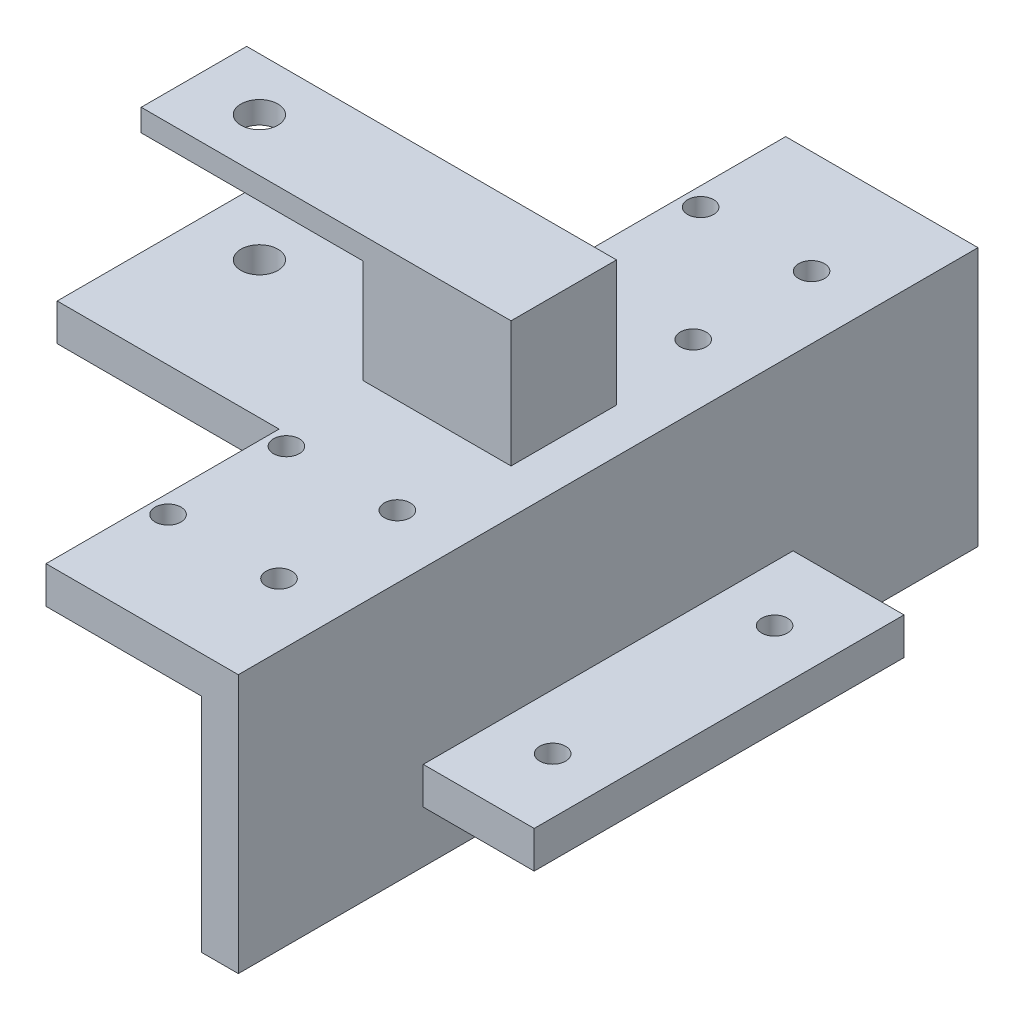
from build123d import *

# Parameters (mm, degrees)
SKETCH1_R               = 1.75
BOSS_EXTRUDE1_DEPTH     = 5
SKETCH2_W               = 100
SKETCH2_H               = 35
BOSS_EXTRUDE2_DEPTH     = 5
SKETCH3_W               = 50
SKETCH3_H               = 5
BOSS_EXTRUDE3_DEPTH     = 15
SKETCH4_R               = 1.75
CUT_EXTRUDE1_DEPTH      = 64.166446789
SKETCH5_W               = 20
SKETCH5_H               = 14.257959778
BOSS_EXTRUDE4_DEPTH     = 17
SKETCH6_W               = 14.257959778
SKETCH6_H               = 3
SKETCH6_W_2             = 36.976915342
SKETCH6_H_2             = 5
BOSS_EXTRUDE5_DEPTH     = 30
CUT_EXTRUDE2_DEPTH      = 73.972597597
CUT_EXTRUDE2_DEPTH_BACK = 73.972597597
SKETCH7_R               = 2.5


with BuildPart() as part:
    # Sketch1 → Boss-Extrude1 (new body)
    with BuildSketch(Plane(origin=(0, 0, 0), x_dir=(1, 0, 0), z_dir=(0, 1, 0))):
        Polygon((-10, 50), (10, 50), (11, 50), (11, -50), (10, -50), (-10, -50), align=None)
        with Locations((-7.5, 36)):
            Circle(SKETCH1_R, mode=Mode.SUBTRACT)
        with Locations((7.5, 36)):
            Circle(SKETCH1_R, mode=Mode.SUBTRACT)
        with Locations((-7.5, 20)):
            Circle(SKETCH1_R, mode=Mode.SUBTRACT)
        with Locations((7.5, 20)):
            Circle(SKETCH1_R, mode=Mode.SUBTRACT)
        with Locations((7.5, -20)):
            Circle(SKETCH1_R, mode=Mode.SUBTRACT)
        with Locations((-7.5, -20)):
            Circle(SKETCH1_R, mode=Mode.SUBTRACT)
        with Locations((7.5, -36)):
            Circle(SKETCH1_R, mode=Mode.SUBTRACT)
        with Locations((-7.5, -36)):
            Circle(SKETCH1_R, mode=Mode.SUBTRACT)
    extrude(amount=BOSS_EXTRUDE1_DEPTH)

    # Sketch2 → Boss-Extrude2 (add)
    with BuildSketch(Plane(origin=(11, 0, 0), x_dir=(0, 0, -1), z_dir=(1, 0, 0))):
        with Locations((0, -12.5)):
            Rectangle(SKETCH2_W, SKETCH2_H)
    extrude(amount=BOSS_EXTRUDE2_DEPTH)

    # Sketch3 → Boss-Extrude3 (add)
    with BuildSketch(Plane(origin=(16, 0, 0), x_dir=(0, 0, -1), z_dir=(1, 0, 0))):
        with Locations((0, -20.5)):
            Rectangle(SKETCH3_W, SKETCH3_H)
    extrude(amount=BOSS_EXTRUDE3_DEPTH)

    # Sketch4 → Cut-Extrude1 (cut, through all)
    with BuildSketch(Plane(origin=(0, -18, 0), x_dir=(1, 0, 0), z_dir=(0, 1, 0))):
        with Locations((23.5, 15)):
            Circle(SKETCH4_R)
        with Locations((23.5, -15)):
            Circle(SKETCH4_R)
    extrude(amount=-CUT_EXTRUDE1_DEPTH, mode=Mode.SUBTRACT)

    # Sketch5 → Boss-Extrude4 (add)
    with BuildSketch(Plane(origin=(0, 5, 0), x_dir=(1, 0, 0), z_dir=(0, 1, 0))):
        Rectangle(SKETCH5_W, SKETCH5_H)
    extrude(amount=BOSS_EXTRUDE4_DEPTH)

    # Sketch6 → Boss-Extrude5 (add)
    with BuildSketch(Plane.ZY.offset(10)):
        with Locations((0, 20.5)):
            Rectangle(SKETCH6_W, SKETCH6_H)
        with Locations((0, 2.5)):
            Rectangle(SKETCH6_W_2, SKETCH6_H_2)
    extrude(amount=BOSS_EXTRUDE5_DEPTH)

    # Sketch7 → Cut-Extrude2 (cut, two sides: drawn at the far end of the back side and taken through both)
    with BuildSketch(Plane(origin=(0, 5, 0), x_dir=(1, 0, 0), z_dir=(0, 1, 0)).offset(-CUT_EXTRUDE2_DEPTH_BACK)):
        with Locations((-31.15, 0)):
            Circle(SKETCH7_R)
    extrude(amount=CUT_EXTRUDE2_DEPTH + CUT_EXTRUDE2_DEPTH_BACK, mode=Mode.SUBTRACT)


solid = part.part
